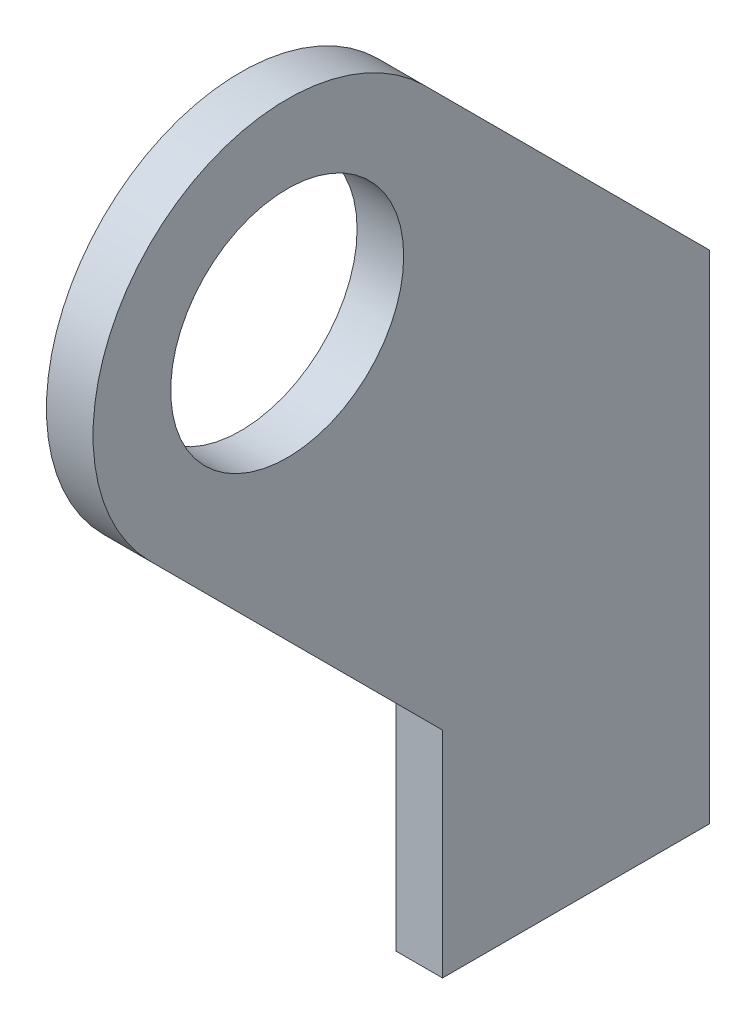
from build123d import *

# Parameters (mm, degrees)
SKETCH1_R           = 7.5
BOSS_EXTRUDE1_DEPTH = 3


with BuildPart() as part:
    # Sketch1 → Boss-Extrude1 (new body)
    with BuildSketch(Plane(origin=(0, 0, 0), x_dir=(0, 0, -1), z_dir=(1, 0, 0))):
        with BuildLine():
            Line((27.17766953, -9.5), (8.838834765, 8.838834765))
            ThreePointArc((8.838834765, 8.838834765), (-8.838834765, 8.838834765), (-8.838834765, -8.838834765))
            Line((-8.838834765, -8.838834765), (10, -27.67766953))
            Line((10, -27.67766953), (10, -41.5))
            Line((10, -41.5), (27.17766953, -41.5))
            Line((27.17766953, -41.5), (27.17766953, -9.5))
        make_face()
        Circle(SKETCH1_R, mode=Mode.SUBTRACT)
    extrude(amount=BOSS_EXTRUDE1_DEPTH)


solid = part.part
